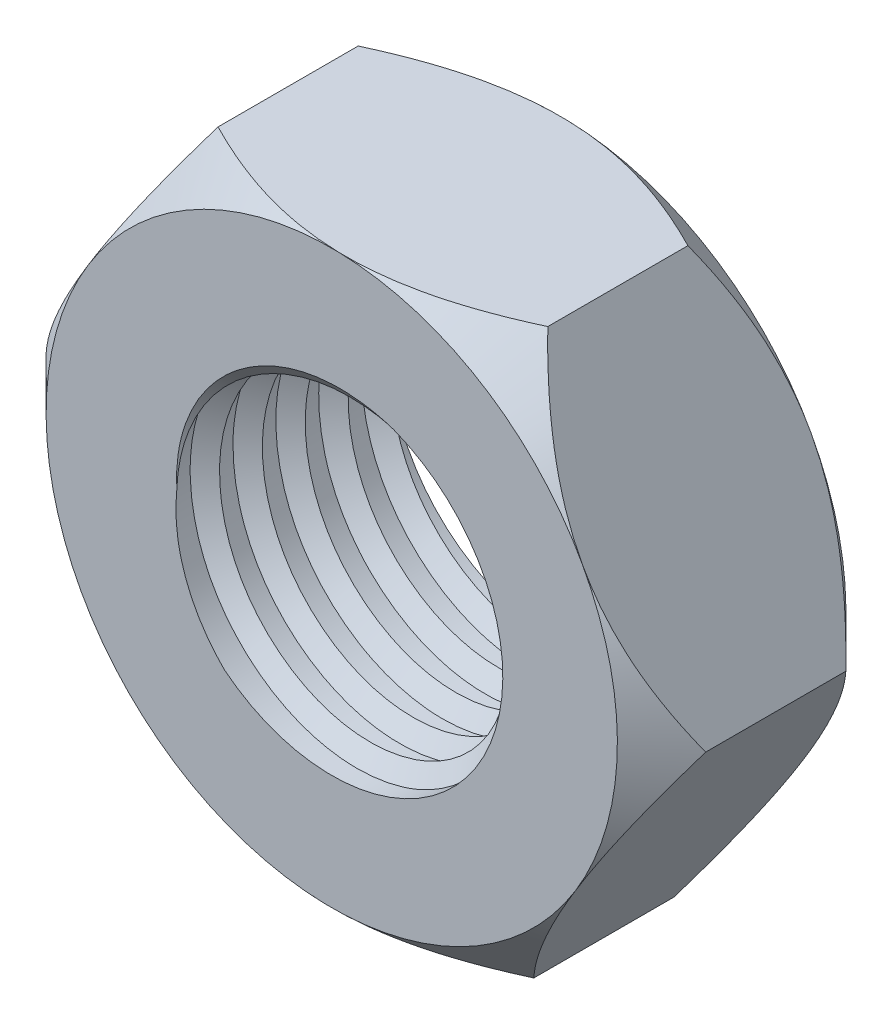
from build123d import *

# Parameters (mm, degrees)
SKETCH1_R           = 5
BOSS_EXTRUDE1_DEPTH = 8
SKETCH2_OUTSIDE_W   = 47.438
SKETCH2_OUTSIDE_H   = 44.626
SKETCH2_OUTSIDE_R   = 10
CUT_EXTRUDE1_DEPTH  = 8
CUT_EXTRUDE1_DRAFT  = -45
SKETCH3_OUTSIDE_W   = 47.438
SKETCH3_OUTSIDE_H   = 44.626
SKETCH3_OUTSIDE_R   = 10
CUT_EXTRUDE2_DEPTH  = 8
CUT_EXTRUDE2_DRAFT  = -45
CUT_SWEEP1_PITCH    = 1.5


with BuildPart() as part:
    # Sketch1 → Boss-Extrude1 (new body)
    with BuildSketch(Plane.XY):
        Polygon((6.015430832, 9.856364707), (-5.52814681, 10.137698269), (-11.543577641, 0.281333561), (-6.015430832, -9.856364707), (5.52814681, -10.137698269), (11.543577641, -0.281333561), align=None)
        Circle(SKETCH1_R, mode=Mode.SUBTRACT)
    extrude(amount=BOSS_EXTRUDE1_DEPTH)


with BuildPart() as cut_extrude1_tool:
    # Sketch2 outside → Cut-Extrude1 (with draft: the straight prism first)
    with BuildSketch(Plane(origin=(0, 0, 0), x_dir=(-1, 0, 0), z_dir=(0, 0, -1))):
        Rectangle(SKETCH2_OUTSIDE_W, SKETCH2_OUTSIDE_H)
        Circle(SKETCH2_OUTSIDE_R, mode=Mode.SUBTRACT)
    extrude(amount=-CUT_EXTRUDE1_DEPTH)
    # Cut-Extrude1: the draft: its side faces are tilted about the plane it starts from
    cut_extrude1_sides = [cut_extrude1_tool.faces().sort_by_distance(p)[0] for p in [
        (0, -22.313, 4),
        (-23.719, 0, 4),
        (0, 22.313, 4),
        (23.719, 0, 4),
        (10, 0, 4),
    ]]
    draft(cut_extrude1_sides, Plane(origin=(0, 0, 0), x_dir=(-1, 0, 0), z_dir=(0, 0, -1)), CUT_EXTRUDE1_DRAFT)


with BuildPart() as part_1:
    add(part.part)

    # Cut-Extrude1: cut by cut_extrude1_tool
    add(cut_extrude1_tool.part, mode=Mode.SUBTRACT)


with BuildPart() as cut_extrude2_tool:
    # Sketch3 outside → Cut-Extrude2 (with draft: the straight prism first)
    with BuildSketch(Plane.XY.offset(8)):
        Rectangle(SKETCH3_OUTSIDE_W, SKETCH3_OUTSIDE_H)
        Circle(SKETCH3_OUTSIDE_R, mode=Mode.SUBTRACT)
    extrude(amount=-CUT_EXTRUDE2_DEPTH)
    # Cut-Extrude2: the draft: its side faces are tilted about the plane it starts from
    cut_extrude2_sides = [cut_extrude2_tool.faces().sort_by_distance(p)[0] for p in [
        (0, -22.313, 4),
        (23.719, 0, 4),
        (0, 22.313, 4),
        (-23.719, 0, 4),
        (-10, 0, 4),
    ]]
    draft(cut_extrude2_sides, Plane.XY.offset(8), CUT_EXTRUDE2_DRAFT)


with BuildPart() as part_2:
    add(part_1.part)

    # Cut-Extrude2: cut by cut_extrude2_tool
    add(cut_extrude2_tool.part, mode=Mode.SUBTRACT)

    # Cut-Sweep1: arcs per turn and ends read off the stored shape
    # Cut-Sweep1: the profile of Sketch5 screwed along a right-hand helix through 10 turns, 8 arcs to a turn; built about Z, then put on its axis
    cut_sweep1_z = Axis((0, 0, 0), (0, 0, 1))
    cut_sweep1_corners = [(5.98886717, 0, -1.213557442), (5.98886717, 0, -2.037714495), (3.918718943, 0, -2.811804588), (4.404584431, 0, 0.092319158)]
    with BuildLine(mode=Mode.PRIVATE) as cut_sweep1_profile:
        Line(cut_sweep1_corners[0], cut_sweep1_corners[1])
        Line(cut_sweep1_corners[1], cut_sweep1_corners[2])
        Line(cut_sweep1_corners[2], cut_sweep1_corners[3])
        Line(cut_sweep1_corners[3], cut_sweep1_corners[0])
    cut_sweep1_cap = Face(cut_sweep1_profile.wire())
    cut_sweep1_turn_angles = [0, 22.5, 45, 67.5, 90, 112.5, 135, 157.5, 180, 202.5, 225, 247.5, 270, 292.5, 315, 337.5, 360]
    cut_sweep1_turn_weights = [1, 0.9238795325112867, 1, 0.9238795325112867, 1, 0.9238795325112867, 1, 0.9238795325112867, 1, 0.9238795325112867, 1, 0.9238795325112867, 1, 0.9238795325112867, 1, 0.9238795325112867, 1]
    cut_sweep1_turn_rails = [Edge.make_bspline([Vector(p[0], p[1], 0).rotate(cut_sweep1_z, cut_sweep1_turn_angles[k]) / cut_sweep1_turn_weights[k] + Vector(0, 0, p[2] + CUT_SWEEP1_PITCH * cut_sweep1_turn_angles[k] / 360) for k in range(17)], [0, 0, 0, 1, 1, 2, 2, 3, 3, 4, 4, 5, 5, 6, 6, 7, 7, 8, 8, 8], 2, cut_sweep1_turn_weights) for p in cut_sweep1_corners]
    cut_sweep1_turn_sides = [Face.make_surface_from_curves(cut_sweep1_turn_rails[p[0]], cut_sweep1_turn_rails[p[1]]) for p in [(0, 1), (1, 2), (2, 3), (3, 0)]]
    cut_sweep1_turn = Solid(Shell([*cut_sweep1_turn_sides, cut_sweep1_cap, cut_sweep1_cap.rotate(cut_sweep1_z, 360).moved(Location((0, 0, CUT_SWEEP1_PITCH * 360 / 360)))]))
    cut_sweep1_each = [*[cut_sweep1_turn.moved(Location((0, 0, CUT_SWEEP1_PITCH * i))) for i in range(10)]]
    add(Plane(origin=(0, 0, 8), x_dir=(1, 0, 0), z_dir=(0, 0, -1)) * Compound([cut_sweep1_each[i] for i in range(0, 10, 2)]), mode=Mode.SUBTRACT)
    add(Plane(origin=(0, 0, 8), x_dir=(1, 0, 0), z_dir=(0, 0, -1)) * Compound([cut_sweep1_each[i] for i in range(1, 10, 2)]), mode=Mode.SUBTRACT)


solid = part_2.part
